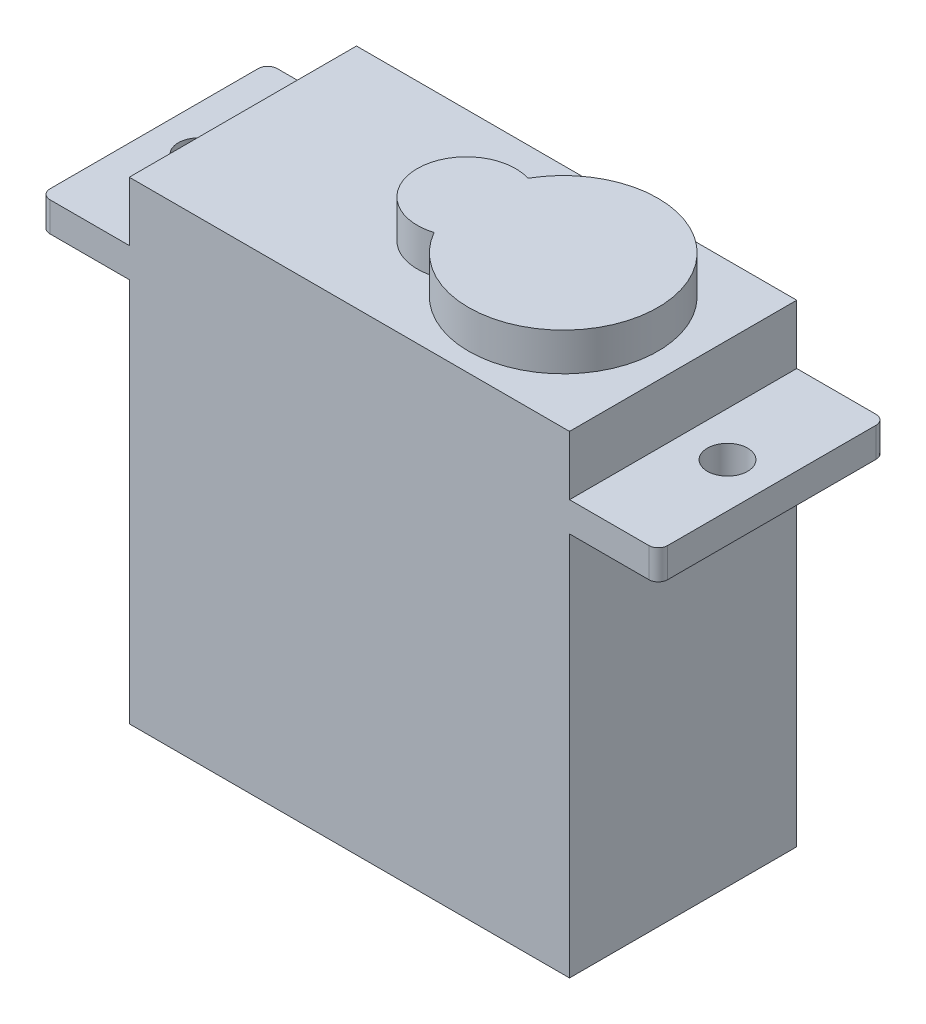
from build123d import *

# Parameters (mm, degrees)
SKETCH1_W           = 23.622
SKETCH1_H           = 12.192
BOSS_EXTRUDE1_DEPTH = 25.4
BOSS_EXTRUDE2_DEPTH = 2.032
SKETCH3_W           = 12.192
SKETCH3_H           = 1.5875
BOSS_EXTRUDE3_DEPTH = 4.7625
CUT_EXTRUDE1_REACH  = 30.386
SKETCH5_R           = 1.0795
FILLET1_R           = 0.508


with BuildPart() as part:
    # Sketch1 → Boss-Extrude1 (new body)
    with BuildSketch(Plane(origin=(0, 0, 0), x_dir=(1, 0, 0), z_dir=(0, 1, 0))):
        Rectangle(SKETCH1_W, SKETCH1_H)
    extrude(amount=BOSS_EXTRUDE1_DEPTH)

    # Sketch2 → Boss-Extrude2 (add)
    with BuildSketch(Plane(origin=(0, 25.4, 0), x_dir=(1, 0, 0), z_dir=(0, 1, 0))):
        with BuildLine():
            ThreePointArc((0.966939793, -2.519878116), (10.459405307, 0), (0.966939793, 2.519878116))
            ThreePointArc((0.966939793, 2.519878116), (-2.454485361, 0), (0.966939793, -2.519878116))
        make_face()
    extrude(amount=BOSS_EXTRUDE2_DEPTH)

    # Sketch3 → Boss-Extrude3 (add)
    with BuildSketch(Plane(origin=(11.811, 0, 0), x_dir=(0, 0, -1), z_dir=(1, 0, 0))):
        with Locations((0, 21.43125)):
            Rectangle(SKETCH3_W, SKETCH3_H)
    boss_extrude3 = extrude(amount=BOSS_EXTRUDE3_DEPTH)

    # Sketch5 → Cut-Extrude1 (cut, up to next)
    with BuildSketch(Plane(origin=(0, 22.225, 0), x_dir=(1, 0, 0), z_dir=(0, 1, 0)), mode=Mode.PRIVATE) as cut_extrude1_sk1:
        with Locations((14.19225, 0)):
            Circle(SKETCH5_R)
    cut_extrude1_tool1 = extrude(cut_extrude1_sk1.sketch, amount=-CUT_EXTRUDE1_REACH, mode=Mode.PRIVATE) & part.part
    cut_extrude1 = cut_extrude1_tool1.solids().sort_by_distance((14.19225, 22.225, 0))[0]
    add(cut_extrude1, mode=Mode.SUBTRACT)

    # Mirror1: Boss-Extrude3, Cut-Extrude1 across plane
    add(boss_extrude3.mirror(Plane(origin=(0, 0, 0), x_dir=(0, 0, 1), z_dir=(1, 0, 0))))
    add(cut_extrude1.mirror(Plane(origin=(0, 0, 0), x_dir=(0, 0, 1), z_dir=(1, 0, 0))), mode=Mode.SUBTRACT)

    # Fillet1
    fillet1_edges = [part.edges().sort_by_distance(p)[0] for p in [
        (16.5735, 21.43125, 6.096),
        (16.5735, 21.43125, -6.096),
        (-16.5735, 21.43125, -6.096),
        (-16.5735, 21.43125, 6.096),
    ]]
    fillet(fillet1_edges, radius=FILLET1_R)


solid = part.part
